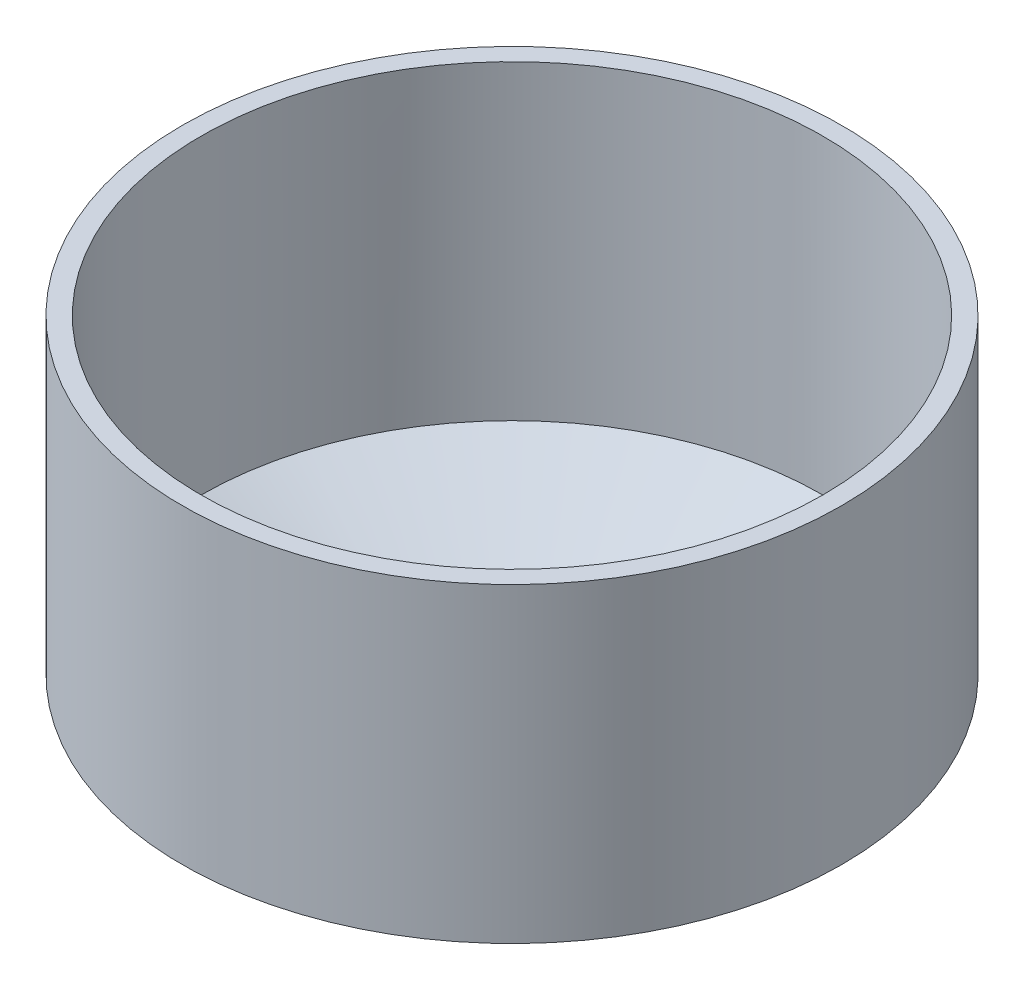
from build123d import *


with BuildPart() as part:
    # Sketch2 → Revolve2 (revolve)
    with BuildSketch(Plane.XY):
        Polygon((21.2, 20), (21.2, 0), (7.2, -6.932208818), (6, -6.932208818), (20, 0), (20, 20), align=None)
    revolve(axis=Axis((0, -1000, 0), (0, 1, 0)))


solid = part.part
